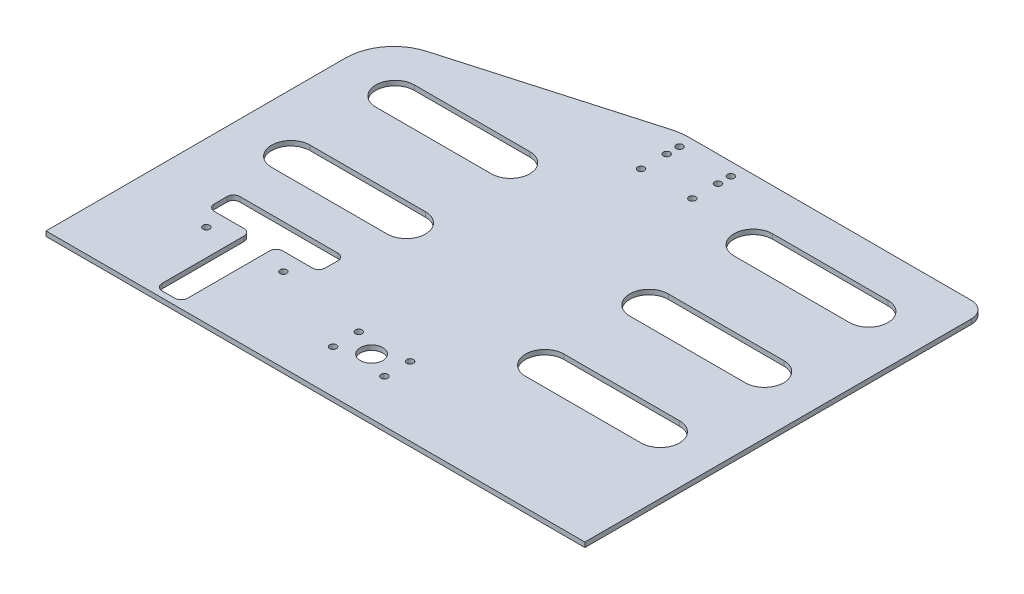
from build123d import *

# Parameters (mm, degrees)
SIDEPLATERIGHT_MIRRORED1_START       = -3
SIDEPLATERIGHT_MIRRORED1_OUTLINE_R   = 2.1
SIDEPLATERIGHT_MIRRORED1_OUTLINE_R_2 = 7
SIDEPLATERIGHT_MIRRORED1_DEPTH       = 3
BOSS_EXTRUDE1_DEPTH                  = 3
FILLET1_R                            = 40
SKETCH3_R                            = 2.1
CUT_EXTRUDE1_DEPTH                   = 3
CUT_EXTRUDE3_DEPTH                   = 274.658546368
CUT_EXTRUDE3_DEPTH_BACK              = 274.658546368
SKETCH5_W                            = 336
SKETCH5_H                            = 4


# Read off the part's stored shape, not the designer's step: sidePlateRight_Mirrored1
with BuildPart() as part:
    # sidePlateRight_Mirrored1 outline → sidePlateRight_Mirrored1 (new body)
    with BuildSketch(Plane(origin=(0, 0, 0), x_dir=(1, 0, 0), z_dir=(0, 1, 0)).offset(SIDEPLATERIGHT_MIRRORED1_START)):
        with BuildLine():
            Line((168, -39), (168, 206))
            ThreePointArc((168, 206), (165.071067812, 213.071067812), (158, 216))
            Line((158, 216), (-23, 216))
            Line((-23, 216), (-23, 60))
            ThreePointArc((-23, 60), (-24.171572875, 57.171572875), (-27, 56))
            Line((-27, 56), (-158, 56))
            ThreePointArc((-158, 56), (-165.071067812, 53.071067812), (-168, 46))
            Line((-168, 46), (-168, -39))
            Line((-168, -39), (168, -39))
        make_face()
        with BuildLine():
            ThreePointArc((-87.5, -27.189984024), (-88.671572875, -30.018411149), (-91.5, -31.189984024))
            Line((-91.5, -31.189984024), (-99.5, -31.189984024))
            ThreePointArc((-99.5, -31.189984024), (-102.328427125, -30.018411149), (-103.5, -27.189984024))
            Line((-103.5, -27.189984024), (-103.5, 24))
            ThreePointArc((-103.5, 24), (-104.671572875, 26.828427125), (-107.5, 28))
            Line((-107.5, 28), (-126.109686491, 28))
            ThreePointArc((-126.109686491, 28), (-128.938113615, 29.171572876), (-130.109686491, 32))
            Line((-130.109686491, 32), (-130.109686491, 40))
            ThreePointArc((-130.109686491, 40), (-128.938113615, 42.828427124), (-126.109686491, 44))
            Line((-126.109686491, 44), (-64.890313509, 44))
            ThreePointArc((-64.890313509, 44), (-62.061886384, 42.828427124), (-60.890313509, 40))
            Line((-60.890313509, 40), (-60.890313509, 32))
            ThreePointArc((-60.890313509, 32), (-62.061886384, 29.171572876), (-64.890313509, 28))
            Line((-64.890313509, 28), (-83.5, 28))
            ThreePointArc((-83.5, 28), (-86.328427125, 26.828427125), (-87.5, 24))
            Line((-87.5, 24), (-87.5, -27.189984024))
        make_face(mode=Mode.SUBTRACT)
        with Locations((-16, -8)):
            Circle(SIDEPLATERIGHT_MIRRORED1_OUTLINE_R, mode=Mode.SUBTRACT)
        with Locations((-16, 8)):
            Circle(SIDEPLATERIGHT_MIRRORED1_OUTLINE_R, mode=Mode.SUBTRACT)
        with Locations((16, -8)):
            Circle(SIDEPLATERIGHT_MIRRORED1_OUTLINE_R, mode=Mode.SUBTRACT)
        Circle(SIDEPLATERIGHT_MIRRORED1_OUTLINE_R_2, mode=Mode.SUBTRACT)
        with Locations((16, 8)):
            Circle(SIDEPLATERIGHT_MIRRORED1_OUTLINE_R, mode=Mode.SUBTRACT)
        with BuildLine():
            ThreePointArc((60, 36), (48, 48), (60, 60))
            Line((60, 60), (132, 60))
            ThreePointArc((132, 60), (144, 48), (132, 36))
            Line((132, 36), (60, 36))
        make_face(mode=Mode.SUBTRACT)
        with Locations((-16, 184)):
            Circle(SIDEPLATERIGHT_MIRRORED1_OUTLINE_R, mode=Mode.SUBTRACT)
        with Locations((-16, 200)):
            Circle(SIDEPLATERIGHT_MIRRORED1_OUTLINE_R, mode=Mode.SUBTRACT)
        with Locations((-16, 208)):
            Circle(SIDEPLATERIGHT_MIRRORED1_OUTLINE_R, mode=Mode.SUBTRACT)
        with BuildLine():
            ThreePointArc((60, 101), (48, 113), (60, 125))
            Line((60, 125), (132, 125))
            ThreePointArc((132, 125), (144, 113), (132, 101))
            Line((132, 101), (60, 101))
        make_face(mode=Mode.SUBTRACT)
        with Locations((16, 184)):
            Circle(SIDEPLATERIGHT_MIRRORED1_OUTLINE_R, mode=Mode.SUBTRACT)
        with Locations((16, 200)):
            Circle(SIDEPLATERIGHT_MIRRORED1_OUTLINE_R, mode=Mode.SUBTRACT)
        with Locations((16, 208)):
            Circle(SIDEPLATERIGHT_MIRRORED1_OUTLINE_R, mode=Mode.SUBTRACT)
        with BuildLine():
            ThreePointArc((60, 166), (48, 178), (60, 190))
            Line((60, 190), (132, 190))
            ThreePointArc((132, 190), (144, 178), (132, 166))
            Line((132, 166), (60, 166))
        make_face(mode=Mode.SUBTRACT)
    extrude(amount=SIDEPLATERIGHT_MIRRORED1_DEPTH)

    # Sketch1 → Boss-Extrude1 (add)
    with BuildSketch(Plane(origin=(0, 0, 0), x_dir=(1, 0, 0), z_dir=(0, 1, 0))):
        with BuildLine():
            Line((-168, 46), (-168, 151.833913223))
            ThreePointArc((-168, 151.833913223), (-161.957805488, 169.890035626), (-146.265096253, 180.672917782))
            Line((-146.265096253, 180.672917782), (-23, 216))
            Line((-23, 216), (-23, 46))
            Line((-23, 46), (-168, 46))
        make_face()
        with BuildLine():
            Line((-132, 93.668808042), (-60, 93.668808042))
            ThreePointArc((-60, 93.668808042), (-48, 81.668808042), (-60, 69.668808042))
            Line((-60, 69.668808042), (-132, 69.668808042))
            ThreePointArc((-132, 69.668808042), (-144, 81.668808042), (-132, 93.668808042))
        make_face(mode=Mode.SUBTRACT)
        with BuildLine():
            Line((-132, 158.668808042), (-60, 158.668808042))
            ThreePointArc((-60, 158.668808042), (-48, 146.668808042), (-60, 134.668808042))
            Line((-60, 134.668808042), (-132, 134.668808042))
            ThreePointArc((-132, 134.668808042), (-144, 146.668808042), (-132, 158.668808042))
        make_face(mode=Mode.SUBTRACT)
    extrude(amount=-BOSS_EXTRUDE1_DEPTH)

    # Fillet1
    fillet1_edges = [part.edges().sort_by_distance(p)[0] for p in [
        (-23, -1.5, -216),
    ]]
    fillet(fillet1_edges, radius=FILLET1_R)

    # Sketch3 → Cut-Extrude1 (cut)
    with BuildSketch(Plane(origin=(0, 0, 0), x_dir=(1, 0, 0), z_dir=(0, 1, 0))):
        with Locations(Location((-120, 17, 0), (0, 0, 270))):
            Circle(SKETCH3_R)
        with Locations(Location((-72, 17, 0), (0, 0, 270))):
            Circle(SKETCH3_R)
    extrude(amount=-CUT_EXTRUDE1_DEPTH, mode=Mode.SUBTRACT)

    # Sketch5 → Cut-Extrude3 (cut, two sides: drawn at the far end of the back side and taken through both)
    with BuildSketch(Plane(origin=(0, 0, 0), x_dir=(1, 0, 0), z_dir=(0, 1, 0)).offset(-CUT_EXTRUDE3_DEPTH_BACK)):
        with Locations((0, -37)):
            Rectangle(SKETCH5_W, SKETCH5_H)
    extrude(amount=CUT_EXTRUDE3_DEPTH + CUT_EXTRUDE3_DEPTH_BACK, mode=Mode.SUBTRACT)


solid = part.part
